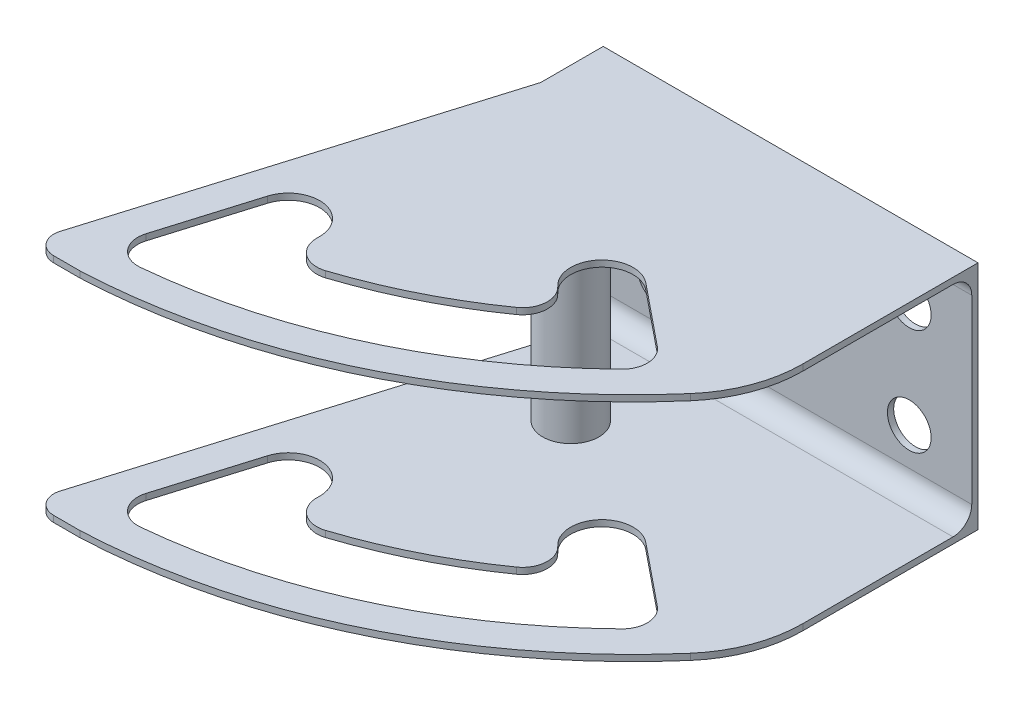
from build123d import *

# Parameters (mm, degrees)
CROQUIS1_W                   = 79
CROQUIS1_H                   = 35
SALIENTE_EXTRUIR1_DEPTH      = 1
SALIENTE_EXTRUIR3_DEPTH      = 72
SALIENTE_EXTRUIR3_DEPTH_BACK = 1
CROQUIS2_W                   = 79
CROQUIS2_H                   = 1
CORTAR_EXTRUIR1_DEPTH        = 72
CORTAR_EXTRUIR2_DEPTH        = 72
CORTAR_EXTRUIR3_DEPTH        = 72
REDONDEO4_R                  = 3
REDONDEO5_R                  = 20
REDONDEO6_R                  = 3
CORTAR_EXTRUIR4_DEPTH        = 72
REDONDEO7_START              = -18.5
REDONDEO7_DEPTH              = 1
REDONDEO7_2_DEPTH            = 1
REDONDEO8_R                  = 4
REDONDEO9_R                  = 3
CROQUIS8_R                   = 3.5
CORTAR_EXTRUIR5_DEPTH        = 72
CROQUIS13_R                  = 4.5
SALIENTE_EXTRUIR7_DEPTH      = 37


with BuildPart() as part:
    # Croquis1 → Saliente-Extruir1 (new body)
    with BuildSketch(Plane.XY):
        Rectangle(CROQUIS1_W, CROQUIS1_H)
    extrude(amount=SALIENTE_EXTRUIR1_DEPTH)

    # Croquis2 → Saliente-Extruir3 (add, two sides: drawn at the far end of the back side and taken through both)
    with BuildSketch(Plane.XY.offset(1).offset(-SALIENTE_EXTRUIR3_DEPTH_BACK)):
        with Locations((0, -18)):
            Rectangle(CROQUIS2_W, CROQUIS2_H)
        with Locations((0, 18)):
            Rectangle(CROQUIS2_W, CROQUIS2_H)
    extrude(amount=SALIENTE_EXTRUIR3_DEPTH + SALIENTE_EXTRUIR3_DEPTH_BACK)

    # Croquis3 → Cortar-Extruir1 (cut)
    with BuildSketch(Plane.XZ.offset(18.5)):
        Polygon((-39.5, 1), (-20.5, 1), (-20.5, 10), (-39.5, 73), align=None)
    extrude(amount=-CORTAR_EXTRUIR1_DEPTH, mode=Mode.SUBTRACT)

    # Croquis4 → Cortar-Extruir2 (cut)
    with BuildSketch(Plane.XY.offset(1)):
        Polygon((-20.5, 17.5), (-20.5, 18.5), (-39.5, 18.5), (-39.5, -18.5), (-20.5, -18.5), (-20.5, -17.5), align=None)
    extrude(amount=-CORTAR_EXTRUIR2_DEPTH, mode=Mode.SUBTRACT)

    # Croquis5 → Cortar-Extruir3 (cut)
    with BuildSketch(Plane.XZ.offset(18.5)):
        with BuildLine():
            ThreePointArc((-31.235435529, 73), (8.464348123, 62.063962298), (39.5, 35))
            Line((39.5, 35), (39.5, 73))
            Line((39.5, 73), (-31.235435529, 73))
        make_face()
    extrude(amount=-CORTAR_EXTRUIR3_DEPTH, mode=Mode.SUBTRACT)

    # Redondeo4
    redondeo4_edges = [part.edges().sort_by_distance(p)[0] for p in [
        (-39.5, -18, 73),
    ]]
    fillet(redondeo4_edges, radius=REDONDEO4_R)

    # Redondeo5
    redondeo5_edges = [part.edges().sort_by_distance(p)[0] for p in [
        (39.5, 18, 35),
        (39.5, -18, 35),
    ]]
    fillet(redondeo5_edges, radius=REDONDEO5_R)

    # Redondeo6
    redondeo6_edges = [part.edges().sort_by_distance(p)[0] for p in [
        (-39.5, 18, 73),
    ]]
    fillet(redondeo6_edges, radius=REDONDEO6_R)

    # Croquis6 → Cortar-Extruir4 (cut)
    with BuildSketch(Plane.XZ.offset(18.5)):
        with BuildLine():
            Line((16.016209597, 29.655049393), (16.02986755, 29.640967118))
            Line((16.02986755, 29.640967118), (20.305135111, 33.109993252))
            Line((20.305135111, 33.109993252), (20.307251231, 33.111710308))
            Line((20.307251231, 33.111710308), (28.870480014, 40.060062433))
            ThreePointArc((28.870480014, 40.060062433), (5.697385816, 57.873252637), (-22.045320516, 67.073485531))
            ThreePointArc((-22.045320516, 67.073485531), (-26.684583157, 67.660916613), (-31.348578825, 68))
            Line((-31.348578825, 68), (-32.769624166, 68))
            Line((-32.769624166, 68), (-26.623611491, 47.621115867))
            ThreePointArc((-26.623611491, 47.621115867), (-20.392867483, 44.277789814), (-17.049541429, 50.508533823))
            Line((-17.049541429, 50.508533823), (-18.465863192, 55.204758613))
            ThreePointArc((-18.465863192, 55.204758613), (-1.905942772, 49.399230787), (12.898781807, 39.978230428))
            ThreePointArc((12.898781807, 39.978230428), (12.954271862, 39.933178304), (13.009719865, 39.888074435))
            Line((13.009719865, 39.888074435), (9.803992697, 37.43240656))
            Line((9.803992697, 37.43240656), (9.202695315, 36.971797598))
            ThreePointArc((9.202695315, 36.971797598), (9.127703809, 36.903372112), (9.054116963, 36.833438221))
            ThreePointArc((9.054116963, 36.833438221), (8.795597311, 29.925261077), (15.685593651, 29.361617315))
            ThreePointArc((15.685593651, 29.361617315), (15.85414601, 29.504677838), (16.016209597, 29.655049393))
        make_face()
    extrude(amount=-CORTAR_EXTRUIR4_DEPTH, mode=Mode.SUBTRACT)

    # Redondeo7: read off the stored shape, not the designer's step
    # Redondeo7 outline → Redondeo7 (cut)
    with BuildSketch(Plane(origin=(0, 0, 0), x_dir=(1, 0, 0), z_dir=(0, 1, 0)).offset(REDONDEO7_START)):
        with BuildLine():
            ThreePointArc((9.143619043, -36.918128357), (10.421654669, -40.121349), (8.732679814, -43.12823468))
            ThreePointArc((8.732679814, -43.12823468), (10.899572634, -41.545606896), (13.009719865, -39.888074435))
            Line((13.009719865, -39.888074435), (9.202695315, -36.971797598))
            ThreePointArc((9.202695315, -36.971797598), (9.173050087, -36.945080858), (9.143619043, -36.918128357))
        make_face()
        with BuildLine():
            ThreePointArc((-18.465863192, -55.204758613), (-15.014619907, -54.339507434), (-11.607267341, -53.314964462))
            ThreePointArc((-11.607267341, -53.314964462), (-15.276738996, -52.690173302), (-16.842756461, -49.313344091))
            ThreePointArc((-16.842756461, -49.313344091), (-16.90977213, -49.917232668), (-17.049541429, -50.508533823))
            Line((-17.049541429, -50.508533823), (-18.465863192, -55.204758613))
        make_face()
    extrude(amount=REDONDEO7_DEPTH, mode=Mode.SUBTRACT)

    # Redondeo7 2 outline → Redondeo7 2 (add)
    with BuildSketch(Plane(origin=(0, 0, 0), x_dir=(1, 0, 0), z_dir=(0, 1, 0)).offset(REDONDEO7_START)):
        with BuildLine():
            ThreePointArc((25.466305511, -37.297856291), (26.941907185, -40.223913599), (25.735427009, -43.270816494))
            ThreePointArc((25.735427009, -43.270816494), (27.323511874, -41.685513114), (28.870480014, -40.060062433))
            Line((28.870480014, -40.060062433), (25.466305511, -37.297856291))
        make_face()
        with BuildLine():
            ThreePointArc((-26.909207237, -67.682994851), (-30.387237337, -66.239442173), (-31.124981113, -62.546709875))
            Line((-31.124981113, -62.546709875), (-32.769624166, -68))
            Line((-32.769624166, -68), (-31.348578825, -68))
            ThreePointArc((-31.348578825, -68), (-29.12687991, -67.869689367), (-26.909207237, -67.682994851))
        make_face()
    extrude(amount=REDONDEO7_2_DEPTH)

    # Redondeo8
    redondeo8_edges = [part.edges().sort_by_distance(p)[0] for p in [
        (-18.465863192, 18, 55.204758613),
        (28.870480014, 18, 40.060062433),
        (-32.769624166, 18, 68),
        (13.009719865, 18, 39.888074435),
    ]]
    fillet(redondeo8_edges, radius=REDONDEO8_R)

    # Redondeo9
    redondeo9_edges = [part.edges().sort_by_distance(p)[0] for p in [
        (9.5, -17.5, 1),
        (9.5, 17.5, 1),
    ]]
    fillet(redondeo9_edges, radius=REDONDEO9_R)

    # Croquis8 → Cortar-Extruir5 (cut)
    with BuildSketch(Plane(origin=(0, 0, 0), x_dir=(-1, 0, 0), z_dir=(0, 0, -1))):
        with Locations((10.5, 8.5)):
            Circle(CROQUIS8_R)
        with Locations((-29.5, 8.5)):
            Circle(CROQUIS8_R)
        with Locations((-29.5, -8.5)):
            Circle(CROQUIS8_R)
        with Locations((10.5, -8.5)):
            Circle(CROQUIS8_R)
    extrude(amount=-CORTAR_EXTRUIR5_DEPTH, mode=Mode.SUBTRACT)

    # Croquis13 → Saliente-Extruir7 (add)
    with BuildSketch(Plane(origin=(0, 18.5, 0), x_dir=(1, 0, 0), z_dir=(0, 1, 0))):
        with Locations(Location((-7.199736414, -18.491822177, 0), (0, 0, 90))):
            Circle(CROQUIS13_R)
    extrude(amount=-SALIENTE_EXTRUIR7_DEPTH)


solid = part.part
